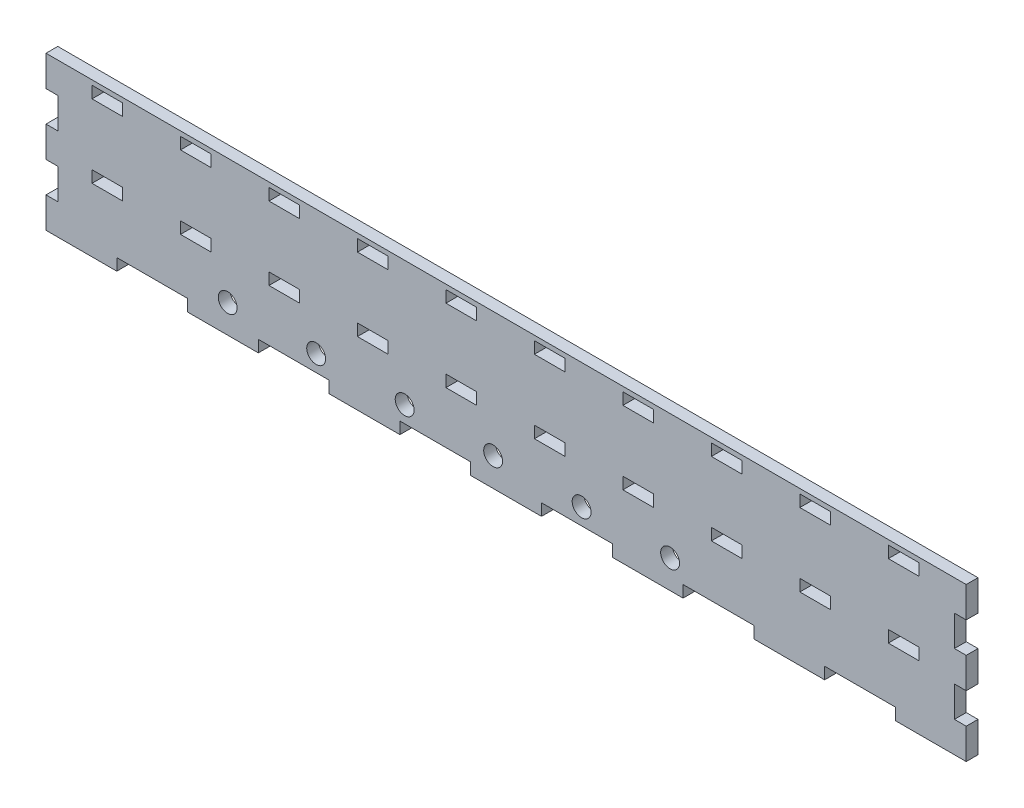
from build123d import *

# Parameters (mm, degrees)
ESQUISSE1_W                     = 390
ESQUISSE1_H                     = 65
BOSS_EXTRU_1_DEPTH              = 5
ESQUISSE2_W                     = 30
ESQUISSE2_H                     = 5
ENL_V_MAT_EXTRU_1_DEPTH         = 5
R_P_TITION_LIN_AIRE1_COUNT      = 6
R_P_TITION_LIN_AIRE1_PITCH      = 60
ESQUISSE3_W                     = 5
ESQUISSE3_H                     = 13
ENL_V_MAT_EXTRU_2_DEPTH         = 5
R_P_TITION_LIN_AIRE2_COUNT      = 2
R_P_TITION_LIN_AIRE2_PITCH      = 26
SYM_TRIE1_COPY_1_SKETCH_W       = 5
SYM_TRIE1_COPY_1_SKETCH_H       = 13
SYM_TRIE1_COPY_1_DEPTH          = 5
SYM_TRIE1_COPY_2_SKETCH_W       = 5
SYM_TRIE1_COPY_2_SKETCH_H       = 13
SYM_TRIE1_COPY_2_DEPTH          = 5
ESQUISSE4_R                     = 4
ENL_V_MAT_EXTRU_3_DEPTH         = 5
R_P_TITION_LIN_AIRE3_COUNT      = 6
R_P_TITION_LIN_AIRE3_PITCH      = 37.5
ESQUISSE5_W                     = 13
ESQUISSE5_H                     = 5
ENL_V_MAT_EXTRU_4_DEPTH         = 5
R_P_TITION_LIN_AIRE4_COUNT      = 2
R_P_TITION_LIN_AIRE4_PITCH      = 37.5
R_P_TITION_LIN_AIRE4_COUNT_DIR2 = 9
R_P_TITION_LIN_AIRE4_PITCH_DIR2 = 37.5


with BuildPart() as part:
    # Esquisse1 → Boss.-Extru.1 (new body)
    with BuildSketch(Plane.XY):
        with Locations((195, -32.5)):
            Rectangle(ESQUISSE1_W, ESQUISSE1_H)
    extrude(amount=BOSS_EXTRU_1_DEPTH)

    # Esquisse2 → Enlèv. mat.-Extru.1 (cut)
    with BuildSketch(Plane.XY.offset(5)):
        with Locations((45, -62.5)):
            Rectangle(ESQUISSE2_W, ESQUISSE2_H)
    enl_v_mat_extru_1 = extrude(amount=-ENL_V_MAT_EXTRU_1_DEPTH, mode=Mode.SUBTRACT)

    # Répétition linéaire1: Enlèv. mat.-Extru.1 ×6
    with Locations(*[(i * R_P_TITION_LIN_AIRE1_PITCH, 0, 0) for i in range(1, R_P_TITION_LIN_AIRE1_COUNT)]):
        add(enl_v_mat_extru_1, mode=Mode.SUBTRACT)

    # Esquisse3 → Enlèv. mat.-Extru.2 (cut)
    with BuildSketch(Plane.XY.offset(5)):
        with Locations((2.5, -45.5)):
            Rectangle(ESQUISSE3_W, ESQUISSE3_H)
    enl_v_mat_extru_2 = extrude(amount=-ENL_V_MAT_EXTRU_2_DEPTH, mode=Mode.SUBTRACT)

    # Répétition linéaire2: Enlèv. mat.-Extru.2 ×2
    with Locations(*[(0, i * R_P_TITION_LIN_AIRE2_PITCH, 0) for i in range(1, R_P_TITION_LIN_AIRE2_COUNT)]):
        add(enl_v_mat_extru_2, mode=Mode.SUBTRACT)

    # Symétrie1 copy 1 sketch → Symétrie1 copy 1 (cut)
    with BuildSketch(Plane(origin=(390, 26, 5), x_dir=(-1, 0, 0), z_dir=(0, 0, 1))):
        with Locations((2.5, 45.5)):
            Rectangle(SYM_TRIE1_COPY_1_SKETCH_W, SYM_TRIE1_COPY_1_SKETCH_H)
    extrude(amount=-SYM_TRIE1_COPY_1_DEPTH, mode=Mode.SUBTRACT)

    # Symétrie1 copy 2 sketch → Symétrie1 copy 2 (cut)
    with BuildSketch(Plane(origin=(390, 0, 5), x_dir=(-1, 0, 0), z_dir=(0, 0, 1))):
        with Locations((2.5, 45.5)):
            Rectangle(SYM_TRIE1_COPY_2_SKETCH_W, SYM_TRIE1_COPY_2_SKETCH_H)
    extrude(amount=-SYM_TRIE1_COPY_2_DEPTH, mode=Mode.SUBTRACT)

    # Esquisse4 → Enlèv. mat.-Extru.3 (cut)
    with BuildSketch(Plane.XY.offset(5)):
        with Locations((77, -53)):
            Circle(ESQUISSE4_R)
    enl_v_mat_extru_3 = extrude(amount=-ENL_V_MAT_EXTRU_3_DEPTH, mode=Mode.SUBTRACT)

    # Répétition linéaire3: Enlèv. mat.-Extru.3 ×6
    with Locations(*[(i * R_P_TITION_LIN_AIRE3_PITCH, 0, 0) for i in range(1, R_P_TITION_LIN_AIRE3_COUNT)]):
        add(enl_v_mat_extru_3, mode=Mode.SUBTRACT)

    # Esquisse5 → Enlèv. mat.-Extru.4 (cut)
    with BuildSketch(Plane.XY.offset(5)):
        with Locations((63.5, -35.5)):
            Rectangle(ESQUISSE5_W, ESQUISSE5_H)
        with Locations((63.5, -4.5)):
            Rectangle(ESQUISSE5_W, ESQUISSE5_H)
    enl_v_mat_extru_4 = extrude(amount=-ENL_V_MAT_EXTRU_4_DEPTH, mode=Mode.SUBTRACT)

    # Répétition linéaire4: Enl_v. mat.-Extru.4 2 × 9
    with Locations(*[Vector(-1, 0, 0) * (i * R_P_TITION_LIN_AIRE4_PITCH) + Vector(1, 0, 0) * (j * R_P_TITION_LIN_AIRE4_PITCH_DIR2) for i in range(R_P_TITION_LIN_AIRE4_COUNT) for j in range(R_P_TITION_LIN_AIRE4_COUNT_DIR2) if (i, j) != (0, 0)]):
        add(enl_v_mat_extru_4, mode=Mode.SUBTRACT)


solid = part.part
